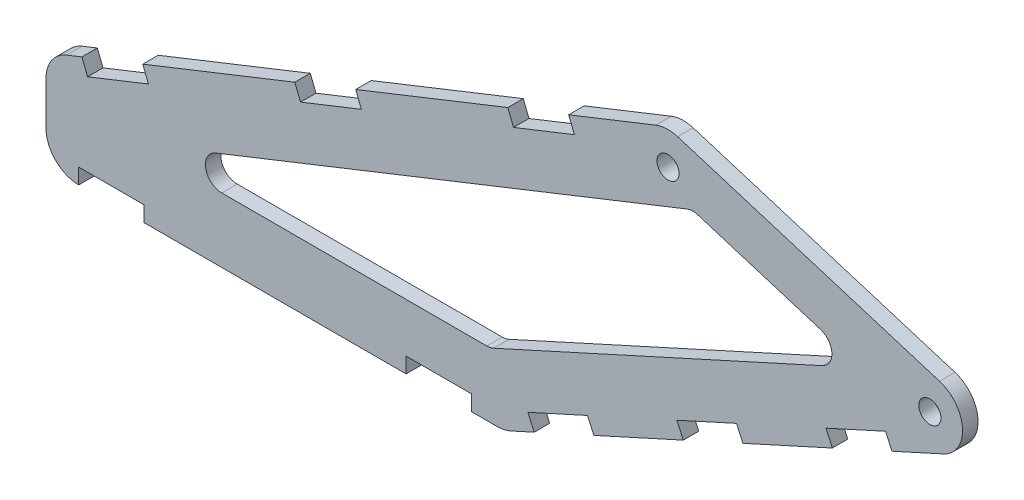
from build123d import *

# Parameters (mm, degrees)
BASE_DEPTH              = 2.9972
JOINT_HOLES_D           = 4.3053
JOINT_HOLES_DEPTH       = 6.351016
OUTER_FILLET_R          = 6.35
SKETCH5_W               = 12.7
SKETCH5_H               = 2.9972
BASE_PLATE_SLOTS_DEPTH  = 142.562822885
UNDER_PLATE_SLOTS_DEPTH = 142.562822885
TOP_PLATE_SLOTS_DEPTH   = 142.562822885
INNER_HOLE_DEPTH        = 142.562822885
INNER_FILLET_R          = 3.175


with BuildPart() as part:
    # Sketch2 → Base (new body)
    with BuildSketch(Plane.XY):
        with BuildLine():
            Line((-44.45, -19.05), (44.45, -19.05))
            Line((44.45, -19.05), (129.624951321, 19.617947547))
            ThreePointArc((129.624951321, 19.617947547), (133.337217148, 25.802714314), (128.871921697, 31.467817496))
            Line((128.871921697, 31.467817496), (78.071921697, 47.139617496))
            ThreePointArc((78.071921697, 47.139617496), (75.950116907, 47.416881437), (73.856688269, 46.973612445))
            Line((73.856688269, 46.973612445), (-44.45, 0))
            Line((-44.45, 0), (-44.45, -19.05))
        make_face()
    extrude(amount=BASE_DEPTH)

    # Joint holes
    with Locations(Plane.XY.offset(2.9972)):
        with Locations((76.2, 41.0718), (127, 25.4)):
            Hole(JOINT_HOLES_D / 2, depth=JOINT_HOLES_DEPTH)

    # Outer fillet
    outer_fillet_edges = [part.edges().sort_by_distance(p)[0] for p in [
        (44.45, -19.05, 1.4986),
        (-44.45, -19.05, 1.4986),
        (-44.45, 0, 1.4986),
    ]]
    fillet(outer_fillet_edges, radius=OUTER_FILLET_R)

    # Sketch5 → Base plate slots (cut, through all)
    with BuildSketch(Plane.XY.offset(2.9972)):
        with Locations((-31.75, -17.5514)):
            Rectangle(SKETCH5_W, SKETCH5_H)
        with Locations((31.75, -17.5514)):
            Rectangle(SKETCH5_W, SKETCH5_H)
    extrude(amount=-BASE_PLATE_SLOTS_DEPTH, mode=Mode.SUBTRACT)

    # Sketch6 → Under plate slots (cut, through all)
    with BuildSketch(Plane.XY.offset(2.9972)):
        Polygon((50.260345678, -16.412204047), (49.021368655, -13.683075289), (60.58547356, -8.433172648), (61.824450584, -11.162301405), align=None)
        Polygon((79.170607941, -3.287447443), (77.931630918, -0.558318686), (89.495735823, 4.691583955), (90.734712847, 1.962455198), align=None)
        Polygon((108.080870204, 9.83730916), (106.841893181, 12.566437917), (118.405998086, 17.816340558), (119.644975109, 15.087211801), align=None)
    extrude(amount=-UNDER_PLATE_SLOTS_DEPTH, mode=Mode.SUBTRACT)

    # Sketch7 → Top plate slots (cut, through all)
    with BuildSketch(Plane.XY.offset(2.9972)):
        Polygon((-37.492405509, 2.762509474), (-36.386362372, -0.023146), (-24.582737483, 4.663477462), (-25.68878062, 7.449132936), align=None)
        Polygon((3.820281603, 19.165691592), (4.92632474, 16.380036118), (16.729949629, 21.06665958), (15.623906492, 23.852315054), align=None)
        Polygon((45.132968715, 35.56887371), (46.239011852, 32.783218236), (58.042636741, 37.469841698), (56.936593604, 40.255497172), align=None)
    extrude(amount=-TOP_PLATE_SLOTS_DEPTH, mode=Mode.SUBTRACT)

    # Sketch8 → Inner hole (cut, through all)
    with BuildSketch(Plane.XY.offset(2.9972)):
        Polygon((-26.957611693, -6.5278), (80.903097736, 36.298241679), (113.752323838, 26.164255426), (41.740634412, -6.5278), align=None)
    extrude(amount=-INNER_HOLE_DEPTH, mode=Mode.SUBTRACT)

    # Inner fillet
    inner_fillet_edges = [part.edges().sort_by_distance(p)[0] for p in [
        (-26.957611693, -6.5278, 1.4986),
        (113.752323838, 26.164255426, 1.4986),
        (41.740634412, -6.5278, 1.4986),
        (80.903097736, 36.298241679, 1.4986),
    ]]
    fillet(inner_fillet_edges, radius=INNER_FILLET_R)


solid = part.part
